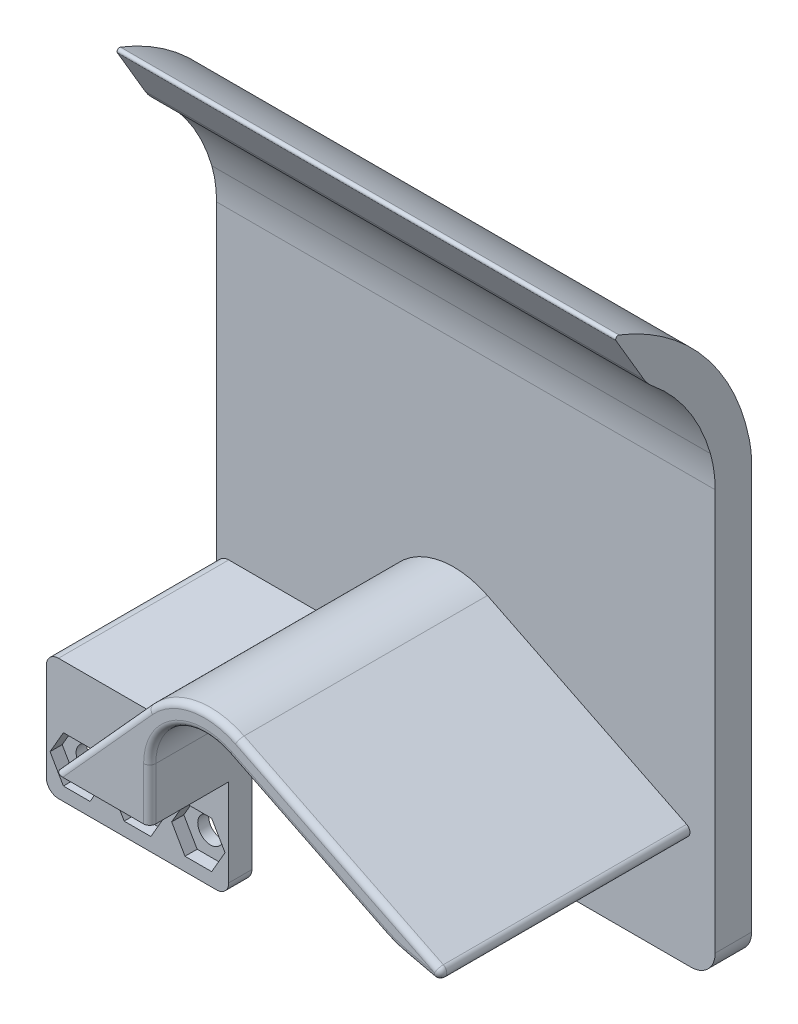
from build123d import *

# Parameters (mm, degrees)
BOSS_EXTRUDE1_DEPTH  = 8.889999999999999
BOSS_EXTRUDE2_DEPTH  = 38.1
SKETCH15_W           = 41.9077442661452
SKETCH15_H           = 43.17111295633907
CUT_EXTRUDE2_DEPTH   = 97.53600000000003
BOSS_EXTRUDE5_START  = 12.7
BOSS_EXTRUDE5_DEPTH  = 12.7
BOSS_EXTRUDE6_DEPTH  = 5.08
BOSS_EXTRUDE7_DEPTH  = 5.08
BOSS_EXTRUDE9_START  = -25.4
BOSS_EXTRUDE9_DEPTH  = 5.08
SKETCH20_R           = 2.6670000000000025
SKETCH20_R_2         = 2.6669999999999994
CUT_EXTRUDE3_DEPTH   = 79.56569416736545
BOSS_EXTRUDE10_START = 43.18
BOSS_EXTRUDE10_DEPTH = 43.18
FILLET2_R            = 2.54
CUT_EXTRUDE4_DEPTH   = 2.54
SKETCH22_W           = 21.77675569209209
SKETCH22_H           = 4.484390369282897
CUT_EXTRUDE5_DEPTH   = 73.97805012467812
BOSS_EXTRUDE11_START = 7.62
SKETCH23_R           = 2.6669999999999994
SKETCH23_R_2         = 2.6670000000000025
BOSS_EXTRUDE11_DEPTH = 7.62
FILLET3_R            = 5.08
BOSS_EXTRUDE12_START = -52.07
BOSS_EXTRUDE12_DEPTH = 52.07
FILLET4_R            = 1.27
FILLET5_R            = 20.32
BOSS_EXTRUDE13_DEPTH = 104.14
FILLET6_R            = 0.508
FILLET7_R            = 7.619999999999999
FILLET8_R            = 25.4
FILLET9_R            = 1.27


with BuildPart() as part:
    # Sketch1 → Boss-Extrude1 (new body)
    with BuildSketch(Plane.XY):
        with BuildLine():
            Line((-31.75, -11.43), (-11.429999999999998, -11.429999999999993))
            Line((-11.429999999999998, -11.429999999999993), (-11.43, 0))
            ThreePointArc((-11.43, 0), (7e-16, 11.43), (11.43, 0))
            Line((11.43, 0), (11.429999999999998, -11.42999999999999))
            Line((11.429999999999998, -11.42999999999999), (31.75, -11.429999999999993))
            Line((31.75, -11.429999999999993), (11.77180119767475, 10.650836660207654))
            ThreePointArc((11.77180119767475, 10.650836660207654), (9.7e-16, 15.875), (-11.771801197674753, 10.65083666020765))
            Line((-11.771801197674753, 10.65083666020765), (-31.75, -11.43))
        make_face()
    extrude(amount=BOSS_EXTRUDE1_DEPTH)

    # Sketch11 → Boss-Extrude2 (add)
    with BuildSketch(Plane(origin=(0, 0, 0), x_dir=(-1, 0, 0), z_dir=(0, 0, -1))):
        Polygon((27.153740742364707, -6.350000000000002), (31.75, -11.43), (11.429999999999998, -11.429999999999993), (11.429999999999996, -6.349999999999992), align=None)
    extrude(amount=BOSS_EXTRUDE2_DEPTH)

    # Sketch15 → Cut-Extrude2 (cut)
    with BuildSketch(Plane.XY.offset(8.889999999999999)):
        with Locations((20.9538721330726, 0.9898585075243087)):
            Rectangle(SKETCH15_W, SKETCH15_H)
    extrude(amount=-CUT_EXTRUDE2_DEPTH, mode=Mode.SUBTRACT)

    # Sketch16 → Boss-Extrude5 (add)
    with BuildSketch(Plane(origin=(0, 0, 0), x_dir=(-1, 0, 0), z_dir=(0, 0, -1)).offset(BOSS_EXTRUDE5_START)):
        with BuildLine():
            Line((11.771801197674753, 10.65083666020765), (27.153740742364707, -6.350000000000003))
            Line((27.153740742364707, -6.350000000000003), (11.429999999999996, -6.349999999999992))
            Line((11.429999999999996, -6.349999999999992), (11.43, -3.9e-15))
            ThreePointArc((11.43, -3.9e-15), (8.082230508962239, 8.082230508962237), (0, 11.43))
            Line((0, 11.43), (0, 15.875))
            ThreePointArc((0, 15.875), (6.4394717570311455, 14.510300771879203), (11.771801197674753, 10.65083666020765))
        make_face()
    extrude(amount=-BOSS_EXTRUDE5_DEPTH)

    # Sketch18 → Boss-Extrude6 (add)
    with BuildSketch(Plane(origin=(4.2e-15, -6.3499999999999845, 0), x_dir=(1, 2.8e-16, 0), z_dir=(-2.8e-16, 1, 0))):
        Polygon((-11.430000000000001, 12.70000000000001), (-49.53, 12.700000000000006), (-49.53, 38.099999999999994), (-11.43, 38.1), align=None)
    extrude(amount=-BOSS_EXTRUDE6_DEPTH)

    # Sketch19 → Boss-Extrude7 (add)
    with BuildSketch(Plane(origin=(0, 0, -38.1), x_dir=(-1, 0, 0), z_dir=(0, 0, -1))):
        Polygon((11.429999999999998, -6.349999999999998), (49.53, -6.349999999999991), (49.53, -31.749999999999986), (11.43, -31.75), align=None)
    extrude(amount=BOSS_EXTRUDE7_DEPTH)

    # Sketch19<3> → Boss-Extrude9 (add)
    with BuildSketch(Plane(origin=(0, 0, -38.1), x_dir=(-1, 0, 0), z_dir=(0, 0, -1)).offset(BOSS_EXTRUDE9_START)):
        Polygon((11.429999999999998, -6.349999999999998), (49.53, -6.349999999999991), (49.53, -31.749999999999986), (11.43, -31.75), align=None)
    extrude(amount=-BOSS_EXTRUDE9_DEPTH)

    # Sketch20 → Cut-Extrude3 (cut, through all)
    with BuildSketch(Plane(origin=(0, 0, -43.18), x_dir=(-1, 0, 0), z_dir=(0, 0, -1))):
        with Locations(Location((30.48, -24.129999999999992, 0), (0, 0, 180))):
            Circle(SKETCH20_R)
        with Locations(Location((17.78, -24.129999999999992, 0), (0, 0, 180))):
            Circle(SKETCH20_R_2)
        with Locations(Location((43.17999999999999, -24.129999999999992, 0), (0, 0, 180))):
            Circle(SKETCH20_R)
    extrude(amount=-CUT_EXTRUDE3_DEPTH, mode=Mode.SUBTRACT)

    # Sketch16<2> → Boss-Extrude10 (add)
    with BuildSketch(Plane(origin=(0, 0, 0), x_dir=(-1, 0, 0), z_dir=(0, 0, -1)).offset(BOSS_EXTRUDE10_START)):
        with BuildLine():
            Line((11.771801197674753, 10.65083666020765), (27.153740742364707, -6.350000000000003))
            Line((27.153740742364707, -6.350000000000003), (11.429999999999996, -6.349999999999992))
            Line((11.429999999999996, -6.349999999999992), (11.43, -3.9e-15))
            ThreePointArc((11.43, -3.9e-15), (8.082230508962239, 8.082230508962237), (0, 11.43))
            Line((0, 11.43), (0, 15.875))
            ThreePointArc((0, 15.875), (6.4394717570311455, 14.510300771879203), (11.771801197674753, 10.65083666020765))
        make_face()
    extrude(amount=-BOSS_EXTRUDE10_DEPTH)

    # Fillet2
    fillet2_edges = [part.edges().sort_by_distance(p)[0] for p in [
        (-11.43, -31.75, -40.64),
        (-49.53, -31.749999999999986, -40.64),
        (-11.43, -31.75, -10.160000000000004),
        (-27.153740742364704, -6.35, -25.400000000000002),
        (-49.53, -31.749999999999986, -10.160000000000004),
        (-49.53, -6.349999999999991, -25.400000000000002),
    ]]
    fillet(fillet2_edges, radius=FILLET2_R)

    # Sketch21 → Cut-Extrude4 (cut)
    with BuildSketch(Plane.XY.offset(-7.620000000000012)):
        Polygon((-27.69370760089086, -19.303999999999988), (-33.26629239910914, -19.303999999999988), (-36.052584798218284, -24.129999999999992), (-33.26629239910914, -28.955999999999996), (-27.693707600890868, -28.955999999999996), (-24.907415201781728, -24.129999999999985), align=None)
        Polygon((-40.393707600890856, -19.303999999999988), (-45.96629239910914, -19.303999999999988), (-48.75258479821828, -24.129999999999992), (-45.96629239910914, -28.955999999999996), (-40.39370760089086, -28.955999999999996), (-37.60741520178173, -24.129999999999985), align=None)
        Polygon((-14.99370760089086, -19.303999999999988), (-20.56629239910914, -19.303999999999988), (-23.352584798218277, -24.129999999999992), (-20.56629239910914, -28.955999999999996), (-14.993707600890867, -28.955999999999996), (-12.20741520178173, -24.129999999999985), align=None)
    extrude(amount=-CUT_EXTRUDE4_DEPTH, mode=Mode.SUBTRACT)

    # Sketch22 → Cut-Extrude5 (cut, through all)
    with BuildSketch(Plane.ZY.offset(49.53)):
        Polygon((-38.354, -11.42999999999998), (-12.446000000000005, -11.42999999999998), (-12.446000000000002, -35.87938903250851), (-38.354, -35.87938903250852), align=None)
        with Locations((3.268377846046038, -13.16419518464144)):
            Rectangle(SKETCH22_W, SKETCH22_H)
    extrude(amount=-CUT_EXTRUDE5_DEPTH, mode=Mode.SUBTRACT)

    # Sketch23 → Boss-Extrude11 (add)
    with BuildSketch(Plane(origin=(0, 0, -43.18), x_dir=(-1, 0, 0), z_dir=(0, 0, -1)).offset(BOSS_EXTRUDE11_START)):
        with BuildLine():
            Line((46.990000000000016, -31.749999999999993), (-54.60999999999998, -31.75))
            Line((-54.60999999999998, -31.75), (-54.60999999999998, 59.690000000000005))
            Line((-54.60999999999998, 59.690000000000005), (49.52999999999999, 59.690000000000005))
            Line((49.52999999999999, 59.690000000000005), (49.53, -29.209999999999987))
            ThreePointArc((49.53, -29.209999999999987), (48.786051224213836, -31.006051224213813), (46.990000000000016, -31.749999999999993))
        make_face()
        with Locations((17.78, -24.129999999999992)):
            Circle(SKETCH23_R, mode=Mode.SUBTRACT)
        with Locations((30.48, -24.129999999999992)):
            Circle(SKETCH23_R_2, mode=Mode.SUBTRACT)
        with Locations((43.17999999999999, -24.129999999999992)):
            Circle(SKETCH23_R_2, mode=Mode.SUBTRACT)
    extrude(amount=-BOSS_EXTRUDE11_DEPTH)

    # Fillet3
    fillet3_edges = [part.edges().sort_by_distance(p)[0] for p in [
        (54.60999999999998, -31.75, -46.989999999999995),
    ]]
    fillet(fillet3_edges, radius=FILLET3_R)

    # Sketch24 → Boss-Extrude12 (add)
    with BuildSketch(Plane.XY.offset(8.889999999999999).offset(BOSS_EXTRUDE12_START)):
        with BuildLine():
            Line((5.067787914863957, 10.245117161358323), (39.587974363799084, -6.83043023839146))
            Line((39.587974363799084, -6.83043023839146), (58.38762081865667, -11.17067060922455))
            Line((58.38762081865667, -11.17067060922455), (7.03859432619994, 14.229329390775446))
            ThreePointArc((7.03859432619994, 14.229329390775446), (3.6142095208661993, 15.458108375195204), (0, 15.875))
            Line((0, 15.875), (-7e-16, 11.43))
            ThreePointArc((-7e-16, 11.43), (2.6022308550236635, 11.129838030140547), (5.067787914863957, 10.245117161358323))
        make_face()
    extrude(amount=BOSS_EXTRUDE12_DEPTH)

    # Fillet4
    # the kernel refuses this fillet: 1.27 mm, written as the material it takes off along each edge
    with BuildSketch(Plane(origin=(58.38762081865667, -11.17067060922455, -43.18), x_dir=(-0.8963357096551464, 0.4433760205480277, 0), z_dir=(0, 0, 1))) as fillet4_piece_1:
        with BuildLine():
            CenterArc((FILLET4_R * 8.56452358423, FILLET4_R), FILLET4_R, 103.31948375813553, 166.68051624186455)
            Line((FILLET4_R * 8.3341429253, FILLET4_R * 1.97310058678), (0, 0))
            Line((0, 0), (FILLET4_R * 8.56452358423, -1.2e-16))
        make_face()
    extrude(amount=79.2623623799331, mode=Mode.SUBTRACT)

    # Fillet5
    fillet5_edges = [part.edges().sort_by_distance(p)[0] for p in [
        (39.587974363799084, -6.83043023839146, -17.145),
    ]]
    fillet(fillet5_edges, radius=FILLET5_R)

    # Sketch25 → Boss-Extrude13 (add)
    with BuildSketch(Plane.ZY.offset(49.53)):
        with BuildLine():
            Line((-29.028140773868504, 83.30403252851806), (-21.7408262217295, 95.69350349416987))
            ThreePointArc((-21.7408262217295, 95.69350349416987), (-41.35451230486861, 81.7952335654154), (-50.800000000000004, 59.69000000000002))
            Line((-50.800000000000004, 59.69000000000002), (-43.18, 59.69000000000002))
            ThreePointArc((-43.18, 59.69000000000002), (-38.40361060567099, 72.87512775034637), (-29.028140773868504, 83.30403252851806))
        make_face()
    extrude(amount=-BOSS_EXTRUDE13_DEPTH)

    # Fillet6
    fillet6_edges = [part.edges().sort_by_distance(p)[0] for p in [
        (2.5399999999999707, 95.69350349416987, -21.7408262217295),
    ]]
    fillet(fillet6_edges, radius=FILLET6_R)

    # Fillet7
    fillet7_edges = [part.edges().sort_by_distance(p)[0] for p in [
        (2.539999999999978, 83.30403252851806, -29.028140773868504),
    ]]
    fillet(fillet7_edges, radius=FILLET7_R)

    # Fillet8
    fillet8_edges = [part.edges().sort_by_distance(p)[0] for p in [
        (2.539999999999999, 59.690000000000005, -50.8),
        (2.539999999999999, 59.690000000000005, -43.18),
    ]]
    fillet(fillet8_edges, radius=FILLET8_R)

    # Fillet9
    fillet9_edges = [part.edges().sort_by_distance(p)[0] for p in [
        (-21.531087635955615, -0.13558166989617781, 8.889999999999999),
        (-11.43, -5.460999999999997, 8.889999999999999),
        (-2.9668526046512183, 15.59530091477155, 8.889999999999999),
        (21.264567959032345, 2.2333155514035123, 8.889999999999999),
        (27.83841048622558, 3.940617675038018, 8.889999999999999),
        (49.271107203403254, -7.9137111445449655, 8.89),
        (44.84459728880309, -8.044017264516304, 8.889999999999999),
        (39.63441669939814, -6.700434090326565, 8.89),
        (-6.029928860820195, 9.710039028420407, 8.889999999999999),
    ]]
    fillet(fillet9_edges, radius=FILLET9_R)


solid = part.part
